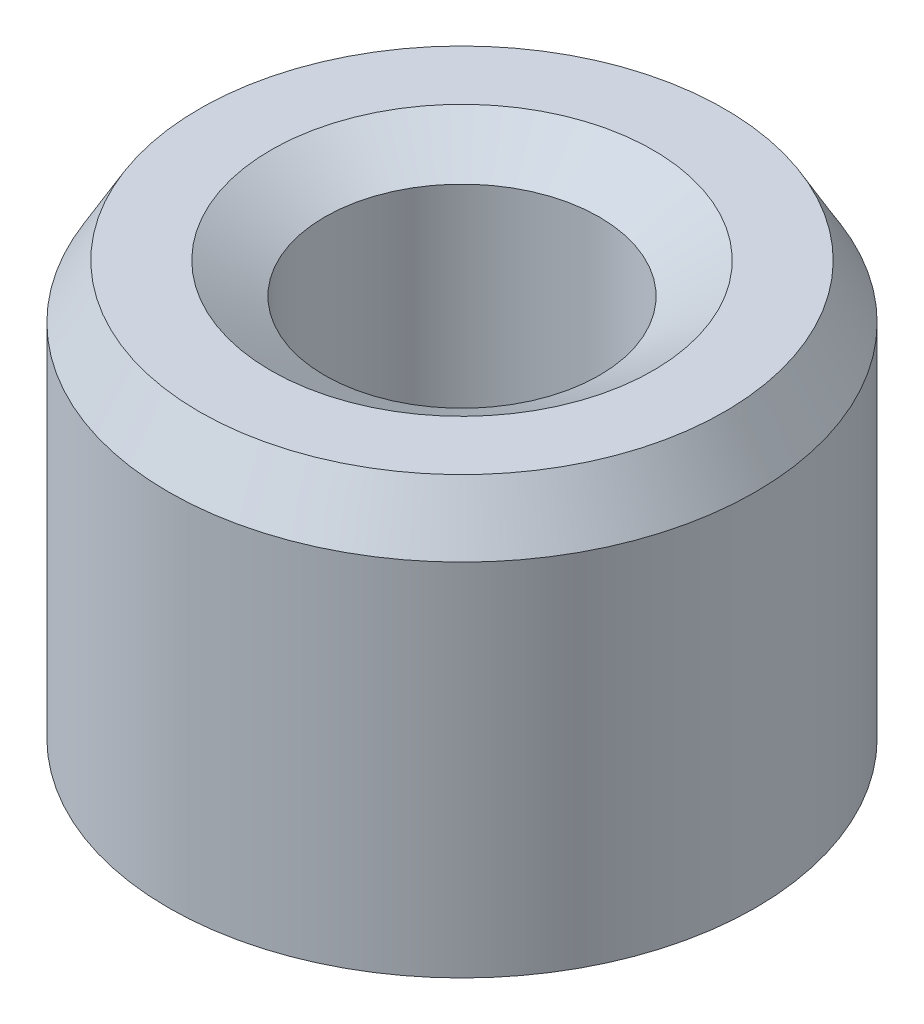
from build123d import *
from OCP.BRepFilletAPI import BRepFilletAPI_MakeChamfer

# Parameters (mm, degrees)
SKETCH1_R           = 5
BOSS_EXTRUDE1_DEPTH = 7.579810389
SKETCH2_R           = 2.338053339
CUT_EXTRUDE1_DEPTH  = 11.365979237
CHAMFER1_SIZE       = 0.916740245
CHAMFER1_SIZE2      = 0.529280227


with BuildPart() as part:
    # Sketch1 → Boss-Extrude1 (new body)
    with BuildSketch(Plane(origin=(0, 0, 0), x_dir=(1, 0, 0), z_dir=(0, 1, 0))):
        Circle(SKETCH1_R)
    extrude(amount=BOSS_EXTRUDE1_DEPTH)

    # Sketch2 → Cut-Extrude1 (cut, through all)
    with BuildSketch(Plane(origin=(0, 0, 0), x_dir=(1, 0, 0), z_dir=(0, 1, 0))):
        Circle(SKETCH2_R)
    extrude(amount=CUT_EXTRUDE1_DEPTH, mode=Mode.SUBTRACT)

    # Chamfer1: one chamfer whose edges measure the first distance from different faces: ONE call of the kernel's chamfer builder (chamfer() names one face for all edges)
    chamfer1_edges_1 = [part.edges().sort_by_distance(p)[0] for p in [
        (-2.338053339, 7.579810389, 0),
    ]]
    chamfer1_side_1 = [part.faces().sort_by_distance(p)[0] for p in [
        (-4.858578644, 7.579810389, 0),
    ]]
    chamfer1_edges_2 = [part.edges().sort_by_distance(p)[0] for p in [
        (-2.338053339, 0, 0),
    ]]
    chamfer1_side_2 = [part.faces().sort_by_distance(p)[0] for p in [
        (-2.338053339, 3.789905195, 0),
    ]]
    chamfer1_edges_3 = [part.edges().sort_by_distance(p)[0] for p in [
        (-5, 0, 0),
    ]]
    chamfer1_side_3 = [part.faces().sort_by_distance(p)[0] for p in [
        (-4.858578644, 0, 0),
    ]]
    chamfer1_edges_4 = [part.edges().sort_by_distance(p)[0] for p in [
        (-5, 7.579810389, 0),
    ]]
    chamfer1_side_4 = [part.faces().sort_by_distance(p)[0] for p in [
        (-5, 3.789905195, 0),
    ]]
    chamfer1 = BRepFilletAPI_MakeChamfer(part.part.solid().wrapped)
    for e in chamfer1_edges_1:
        chamfer1.Add(CHAMFER1_SIZE, CHAMFER1_SIZE2, e.wrapped, chamfer1_side_1[0].wrapped)  # the first distance lies on this face
    for e in chamfer1_edges_2:
        chamfer1.Add(CHAMFER1_SIZE, CHAMFER1_SIZE2, e.wrapped, chamfer1_side_2[0].wrapped)  # the first distance lies on this face
    for e in chamfer1_edges_3:
        chamfer1.Add(CHAMFER1_SIZE, CHAMFER1_SIZE2, e.wrapped, chamfer1_side_3[0].wrapped)  # the first distance lies on this face
    for e in chamfer1_edges_4:
        chamfer1.Add(CHAMFER1_SIZE, CHAMFER1_SIZE2, e.wrapped, chamfer1_side_4[0].wrapped)  # the first distance lies on this face
    add(Compound.cast(chamfer1.Shape()), mode=Mode.REPLACE)


solid = part.part
